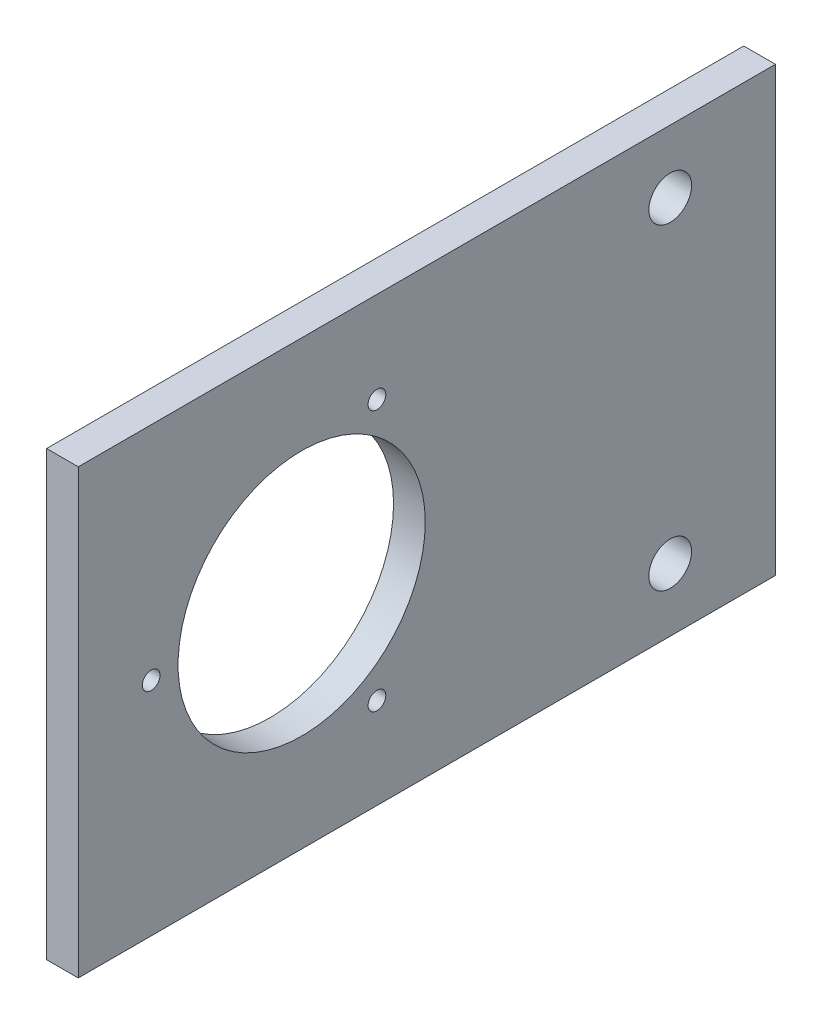
from build123d import *

# Parameters (mm, degrees)
SKETCH1_W           = 69.85
SKETCH1_H           = 110
SKETCH1_R           = 19.5
SKETCH1_R_2         = 3.37312
SKETCH1_R_3         = 1.4
BOSS_EXTRUDE1_DEPTH = 5


with BuildPart() as part:
    # Sketch1 → Boss-Extrude1 (new body)
    with BuildSketch(Plane.YZ):
        Rectangle(SKETCH1_W, SKETCH1_H)
        with Locations((0, 19.75)):
            Circle(SKETCH1_R, mode=Mode.SUBTRACT)
        with Locations((-25, -38.4)):
            Circle(SKETCH1_R_2, mode=Mode.SUBTRACT)
        with Locations((25, -38.4)):
            Circle(SKETCH1_R_2, mode=Mode.SUBTRACT)
        with Locations((-20.56810334, 7.875)):
            Circle(SKETCH1_R_3, mode=Mode.SUBTRACT)
        with Locations((20.56810334, 7.875)):
            Circle(SKETCH1_R_3, mode=Mode.SUBTRACT)
        with Locations((0, 43.5)):
            Circle(SKETCH1_R_3, mode=Mode.SUBTRACT)
    extrude(amount=BOSS_EXTRUDE1_DEPTH)


solid = part.part
